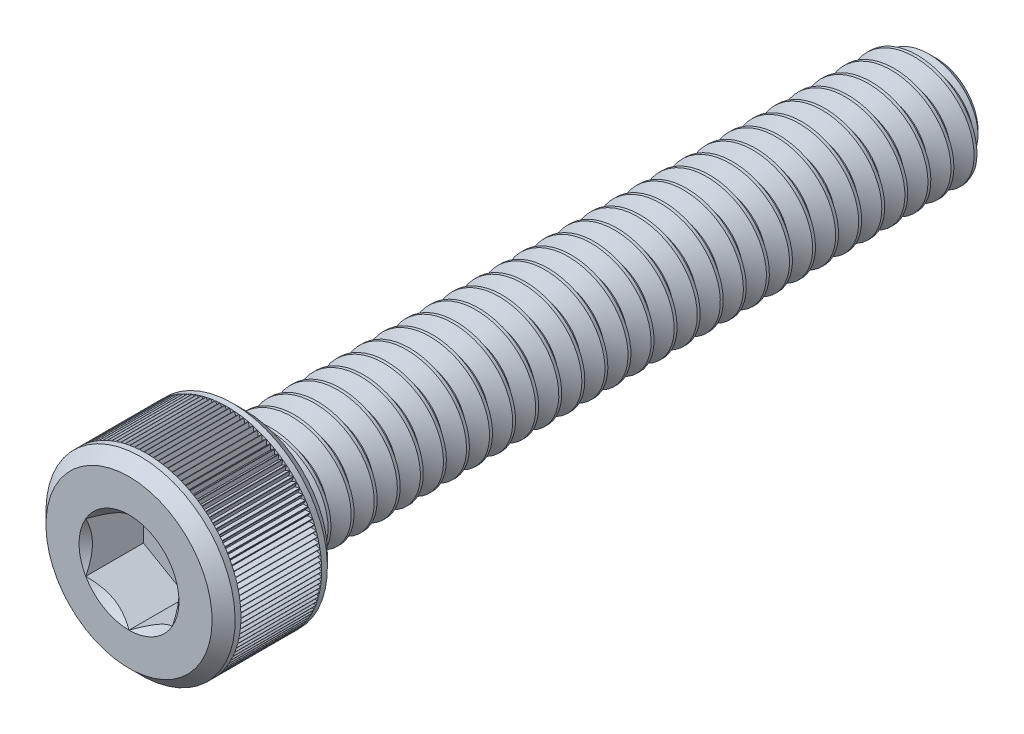
from build123d import *

# Parameters (mm, degrees)
CUT_EXTRUDE1_DEPTH = 1.5875
CUT_SWEEP1_PITCH   = 0.635
CUT_SWEEP1_TO      = 19.05
CUT_EXTRUDE4_DEPTH = 1.11125
CIRPATTERN1_COUNT  = 125


with BuildPart() as part:
    # Sketch3 → Revolve1 (revolve)
    with BuildSketch(Plane(origin=(0, 0, 0), x_dir=(0, 0, -1), z_dir=(1, 0, 0))):
        Polygon((11.1125, 0), (-11.1125, 0), (-11.1125, 2.286), (-10.795, 2.6035), (-8.255, 2.6035), (-7.9375, 2.286), (-7.9375, 1.5875), (10.668, 1.5875), (11.1125, 1.143), align=None)
    revolve(axis=Axis((0, 0, -11.1125), (0, 0, 1)))

    # Sketch4 → Cut-Extrude1 (cut)
    with BuildSketch(Plane.XY.offset(11.1125)):
        Polygon((0, -1.374815329), (1.190625, -0.687407664), (1.190625, 0.687407664), (0, 1.374815329), (-1.190625, 0.687407664), (-1.190625, -0.687407664), align=None)
    extrude(amount=-CUT_EXTRUDE1_DEPTH, mode=Mode.SUBTRACT)

    # Cut-Extrude3 cone 1 section (through the dimple's axis) → Cut-Extrude3 (revolve, cut)
    with BuildSketch(Plane(origin=(0, 0, 11.1125), x_dir=(0, -1, 0), z_dir=(1, 0, 0))):
        Polygon((0, 0), (1.374815329, 0), (0, 1.374815329), align=None)
    revolve(axis=Axis((0, 0, 11.1125), (0, 0, -1)), mode=Mode.SUBTRACT)


with BuildPart() as body_2:
    # Split1: read off the stored shape, not the designer's step
    # Split1: the piece on the far side of the plane
    add(part.part)
    split(bisect_by=Plane.XY.offset(7.9375), keep=Keep.BOTTOM)

    # Cut-Sweep1: arcs per turn and ends read off the stored shape
    # Cut-Sweep1: the profile of Sketch7 screwed along a right-hand helix through 31 turns, 6 arcs to a turn; built about Z, then put on its axis
    cut_sweep1_z = Axis((0, 0, 0), (0, 0, 1))
    cut_sweep1_corners = [(1.621870383, 0, 0.01984375), (1.621870383, 0, -0.57546875), (1.175055401, 0, -0.3175), (1.175055401, 0, -0.238125)]
    with BuildLine(mode=Mode.PRIVATE) as cut_sweep1_profile:
        Line(cut_sweep1_corners[0], cut_sweep1_corners[1])
        Line(cut_sweep1_corners[1], cut_sweep1_corners[2])
        Line(cut_sweep1_corners[2], cut_sweep1_corners[3])
        Line(cut_sweep1_corners[3], cut_sweep1_corners[0])
    cut_sweep1_cap = Face(cut_sweep1_profile.wire())
    cut_sweep1_turn_angles = [0, 30, 60, 90, 120, 150, 180, 210, 240, 270, 300, 330, 360]
    cut_sweep1_turn_weights = [1, 0.8660254037844387, 1, 0.8660254037844387, 1, 0.8660254037844387, 1, 0.8660254037844387, 1, 0.8660254037844387, 1, 0.8660254037844387, 1]
    cut_sweep1_turn_rails = [Edge.make_bspline([Vector(p[0], p[1], 0).rotate(cut_sweep1_z, cut_sweep1_turn_angles[k]) / cut_sweep1_turn_weights[k] + Vector(0, 0, p[2] + CUT_SWEEP1_PITCH * cut_sweep1_turn_angles[k] / 360) for k in range(13)], [0, 0, 0, 1, 1, 2, 2, 3, 3, 4, 4, 5, 5, 6, 6, 6], 2, cut_sweep1_turn_weights) for p in cut_sweep1_corners]
    cut_sweep1_turn_sides = [Face.make_surface_from_curves(cut_sweep1_turn_rails[p[0]], cut_sweep1_turn_rails[p[1]]) for p in [(0, 1), (1, 2), (2, 3), (3, 0)]]
    cut_sweep1 = Plane(origin=(0, 0, -11.1125), x_dir=(0, 1, 0), z_dir=(0, 0, 1)) * split(Solid(Shell([*[p.moved(Location((0, 0, CUT_SWEEP1_PITCH * i))) for i in range(31) for p in cut_sweep1_turn_sides], cut_sweep1_cap, cut_sweep1_cap.rotate(cut_sweep1_z, 11160).moved(Location((0, 0, CUT_SWEEP1_PITCH * 11160 / 360)))])), bisect_by=Plane.XY.offset(CUT_SWEEP1_TO), keep=Keep.BOTTOM, mode=Mode.PRIVATE)
    add(cut_sweep1, mode=Mode.SUBTRACT)


with BuildPart() as part_1:
    add(part.part)

    # Split1
    split(bisect_by=Plane.XY.offset(7.9375), keep=Keep.TOP)

    add(body_2.part)  # Boss-Extrude1 merges body 2
    # Boss-Extrude1 cone 1 section (through the dimple's axis) → Boss-Extrude1 (revolve)
    with BuildSketch(Plane(origin=(0, 0, 7.9375), x_dir=(0, -1, 0), z_dir=(1, 0, 0))):
        Polygon((0, 0), (1.5875, 0), (0, 0.279919082), align=None)
    revolve(axis=Axis((0, 0, 7.9375), (0, 0, -1)))

    # Sketch9 → Cut-Extrude4 (cut, symmetric)
    with BuildSketch(Plane.XY.offset(9.525)):
        with BuildLine():
            Line((-0.060375117, 2.602799857), (0, 2.473325))
            Line((0, 2.473325), (0.060375117, 2.602799857))
            ThreePointArc((0.060375117, 2.602799857), (0, 2.6035), (-0.060375117, 2.602799857))
        make_face()
    cut_extrude4 = extrude(amount=CUT_EXTRUDE4_DEPTH, both=True, mode=Mode.SUBTRACT)

    # CirPattern1: Cut-Extrude4 ×125 about axis
    cirpattern1_axis = Axis((0, 0, 0), (0, 0, 1))
    for i in range(1, CIRPATTERN1_COUNT):
        add(cut_extrude4.rotate(cirpattern1_axis, i * 360 / CIRPATTERN1_COUNT), mode=Mode.SUBTRACT)


solid = part_1.part
